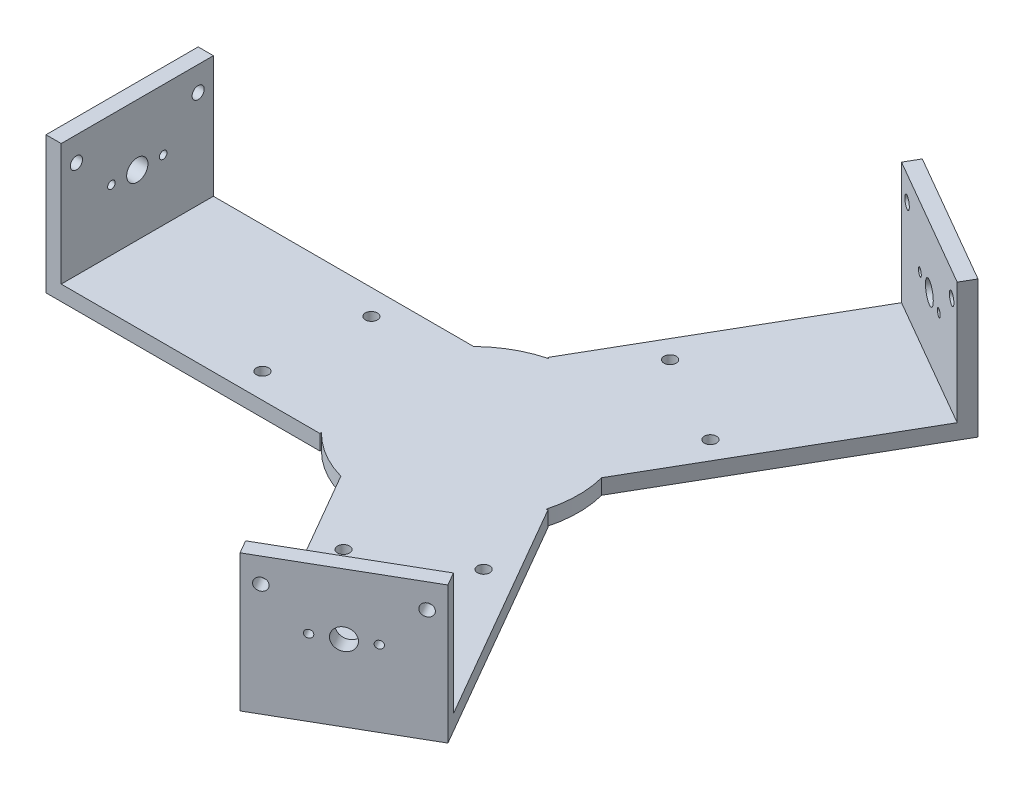
from build123d import *

# Parameters (mm, degrees)
BOSS_EXTRU_3_DEPTH      = 5
ESQUISSE4_W             = 5
ESQUISSE4_H             = 50
BOSS_EXTRU_4_DEPTH      = 40
ESQUISSE5_R             = 3.5
ESQUISSE5_R_2           = 1.25
ENL_V_MAT_EXTRU_1_DEPTH = 225.427684996
ESQUISSE6_R             = 3.5
ESQUISSE6_R_2           = 1.25
ENL_V_MAT_EXTRU_2_DEPTH = 272.884889055
ESQUISSE7_R             = 3.5
ESQUISSE7_R_2           = 1.25
ENL_V_MAT_EXTRU_3_DEPTH = 272.884889055
ESQUISSE8_R             = 2
ENL_V_MAT_EXTRU_4_DEPTH = 166.498710073
ESQUISSE9_R             = 2
ENL_V_MAT_EXTRU_5_DEPTH = 229.657587111
ESQUISSE10_R            = 2
ENL_V_MAT_EXTRU_6_DEPTH = 277.752861
ENL_V_MAT_EXTRU_7_REACH = 278.753
ESQUISSE11_R            = 2


with BuildPart() as part:
    # Esquisse3 → Boss.-Extru.3 (new body)
    with BuildSketch(Plane(origin=(0, 0, 0), x_dir=(1, 0, 0), z_dir=(0, 1, 0))):
        with BuildLine():
            Line((-115, -25), (-25, -25))
            Line((-25, -25), (-24.99494949, -24.500051021))
            ThreePointArc((-24.99494949, -24.500051021), (-17.805293657, -30.132565736), (-9.403186381, -33.713203436))
            Line((-9.403186381, -33.713203436), (35.849364905, -112.092921435))
            Line((35.849364905, -112.092921435), (79.150635095, -87.092921435))
            Line((79.150635095, -87.092921435), (34.150635095, -9.150635095))
            Line((34.150635095, -9.150635095), (33.715141323, -9.396235714))
            ThreePointArc((33.715141323, -9.396235714), (34.998214236, -0.353553761), (33.898083809, 8.713203436))
            Line((33.898083809, 8.713203436), (79.150635095, 87.092921435))
            Line((79.150635095, 87.092921435), (35.849364905, 112.092921435))
            Line((35.849364905, 112.092921435), (-9.150635095, 34.150635095))
            Line((-9.150635095, 34.150635095), (-8.720191833, 33.896286735))
            ThreePointArc((-8.720191833, 33.896286735), (-17.19292058, 30.486119496), (-24.494897428, 25))
            Line((-24.494897428, 25), (-115, 25))
            Line((-115, 25), (-115, -25))
        make_face()
    extrude(amount=BOSS_EXTRU_3_DEPTH)

    # Esquisse4 → Boss.-Extru.4 (add)
    with BuildSketch(Plane(origin=(0, 5, 0), x_dir=(1, 0, 0), z_dir=(0, 1, 0))):
        with Locations((-112.5, 0)):
            Rectangle(ESQUISSE4_W, ESQUISSE4_H)
        Polygon((35.849364905, 112.092921435), (79.150635095, 87.092921435), (76.650635095, 82.762794416), (33.349364905, 107.762794416), align=None)
        Polygon((79.150635095, -87.092921435), (76.650635095, -82.762794416), (33.349364905, -107.762794416), (35.849364905, -112.092921435), align=None)
    extrude(amount=BOSS_EXTRU_4_DEPTH)

    # Esquisse5 → Enlèv. mat.-Extru.1 (cut, through all)
    with BuildSketch(Plane(origin=(-110, 0, 0), x_dir=(0, 0, -1), z_dir=(1, 0, 0))):
        with Locations((0, 25)):
            Circle(ESQUISSE5_R)
        with Locations((-8.5, 25)):
            Circle(ESQUISSE5_R_2)
        with Locations((8.5, 25)):
            Circle(ESQUISSE5_R_2)
    extrude(amount=-ENL_V_MAT_EXTRU_1_DEPTH, mode=Mode.SUBTRACT)

    # Esquisse6 → Enlèv. mat.-Extru.2 (cut, through all)
    with BuildSketch(Plane(origin=(55, 0, 95.262794416), x_dir=(-0.8660254037844386, 0, 0.4999999999999999), z_dir=(-0.49999999999999994, 0, -0.8660254037844387))):
        with Locations((0, 25)):
            Circle(ESQUISSE6_R)
        with Locations((-8.5, 25)):
            Circle(ESQUISSE6_R_2)
        with Locations((8.5, 25)):
            Circle(ESQUISSE6_R_2)
    extrude(amount=-ENL_V_MAT_EXTRU_2_DEPTH, mode=Mode.SUBTRACT)

    # Esquisse7 → Enlèv. mat.-Extru.3 (cut, through all)
    with BuildSketch(Plane(origin=(55, 0, -95.262794416), x_dir=(0.8660254037844388, 0, 0.49999999999999983), z_dir=(-0.4999999999999998, 0, 0.8660254037844387))):
        with Locations((0, 25)):
            Circle(ESQUISSE7_R)
        with Locations((8.5, 25)):
            Circle(ESQUISSE7_R_2)
        with Locations((-8.5, 25)):
            Circle(ESQUISSE7_R_2)
    extrude(amount=-ENL_V_MAT_EXTRU_3_DEPTH, mode=Mode.SUBTRACT)

    # Esquisse8 → Enlèv. mat.-Extru.4 (cut, through all)
    with BuildSketch(Plane(origin=(0, 5, 0), x_dir=(1, 0, 0), z_dir=(0, 1, 0))):
        with Locations((11.915763974, -54.138708614)):
            Circle(ESQUISSE8_R)
        with Locations((40.568493854, -36.766692542)):
            Circle(ESQUISSE8_R)
        with Locations((11.556642828, 53.516692542)):
            Circle(ESQUISSE8_R)
        with Locations((40.927615001, 37.388708614)):
            Circle(ESQUISSE8_R)
        with Locations((-52.125136682, -16.75)):
            Circle(ESQUISSE8_R)
        with Locations((-49.843378975, 16.75)):
            Circle(ESQUISSE8_R)
    extrude(amount=-ENL_V_MAT_EXTRU_4_DEPTH, mode=Mode.SUBTRACT)

    # Esquisse9 → Enlèv. mat.-Extru.5 (cut, through all)
    with BuildSketch(Plane.ZY.offset(115)):
        with Locations((-20, 37)):
            Circle(ESQUISSE9_R)
        with Locations((20, 37)):
            Circle(ESQUISSE9_R)
    extrude(amount=-ENL_V_MAT_EXTRU_5_DEPTH, mode=Mode.SUBTRACT)

    # Esquisse10 → Enlèv. mat.-Extru.6 (cut, through all)
    with BuildSketch(Plane(origin=(57.5, 0, -99.592921435), x_dir=(-0.8660254037844388, 0, -0.49999999999999983), z_dir=(0.4999999999999998, 0, -0.8660254037844387))):
        with Locations((-20, 37)):
            Circle(ESQUISSE10_R)
        with Locations((20, 37)):
            Circle(ESQUISSE10_R)
    extrude(amount=-ENL_V_MAT_EXTRU_6_DEPTH, mode=Mode.SUBTRACT)

    # Esquisse11 → Enlèv. mat.-Extru.7 (cut, up to next)
    with BuildSketch(Plane(origin=(57.5, 0, 99.592921435), x_dir=(0.8660254037844384, 0, -0.5000000000000006), z_dir=(0.5000000000000006, 0, 0.8660254037844384)), mode=Mode.PRIVATE) as enl_v_mat_extru_7_sk1:
        with Locations((20, 37)):
            Circle(ESQUISSE11_R)
    enl_v_mat_extru_7_tool1 = extrude(enl_v_mat_extru_7_sk1.sketch, amount=-ENL_V_MAT_EXTRU_7_REACH, mode=Mode.PRIVATE) & part.part
    # Esquisse11 → Enlèv. mat.-Extru.7 (cut, up to next)
    with BuildSketch(Plane(origin=(57.5, 0, 99.592921435), x_dir=(0.8660254037844384, 0, -0.5000000000000006), z_dir=(0.5000000000000006, 0, 0.8660254037844384)), mode=Mode.PRIVATE) as enl_v_mat_extru_7_sk2:
        with Locations((-20, 37)):
            Circle(ESQUISSE11_R)
    enl_v_mat_extru_7_tool2 = extrude(enl_v_mat_extru_7_sk2.sketch, amount=-ENL_V_MAT_EXTRU_7_REACH, mode=Mode.PRIVATE) & part.part
    add(enl_v_mat_extru_7_tool1.solids().sort_by_distance((74.820508, 37, 89.592921))[0], mode=Mode.SUBTRACT)
    add(enl_v_mat_extru_7_tool2.solids().sort_by_distance((40.179492, 37, 109.592921))[0], mode=Mode.SUBTRACT)


solid = part.part
